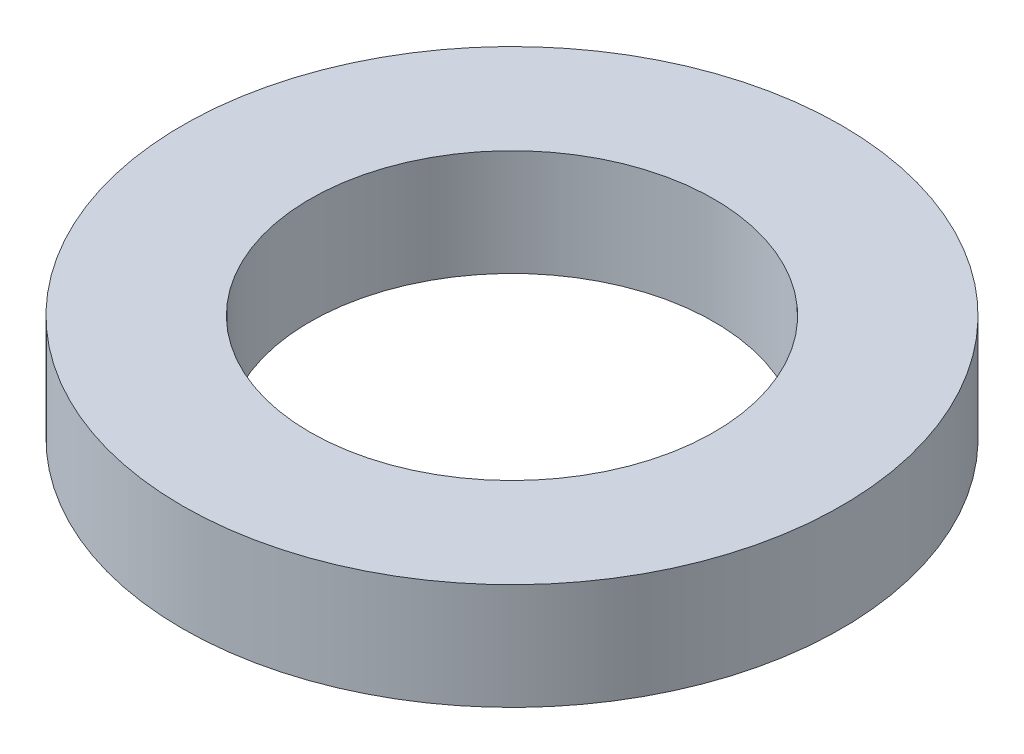
from build123d import *

# Parameters (mm, degrees)
SKETCH1_R           = 77.5
BOSS_EXTRUDE1_DEPTH = 25
SKETCH2_R           = 47.5
CUT_EXTRUDE1_DEPTH  = 113.41663578


with BuildPart() as part:
    # Sketch1 → Boss-Extrude1 (new body)
    with BuildSketch(Plane(origin=(0, 0, 0), x_dir=(1, 0, 0), z_dir=(0, 1, 0))):
        Circle(SKETCH1_R)
    extrude(amount=BOSS_EXTRUDE1_DEPTH)

    # Sketch2 → Cut-Extrude1 (cut, through all)
    with BuildSketch(Plane(origin=(0, 0, 0), x_dir=(1, 0, 0), z_dir=(0, 1, 0))):
        Circle(SKETCH2_R)
    extrude(amount=CUT_EXTRUDE1_DEPTH, mode=Mode.SUBTRACT)


solid = part.part
